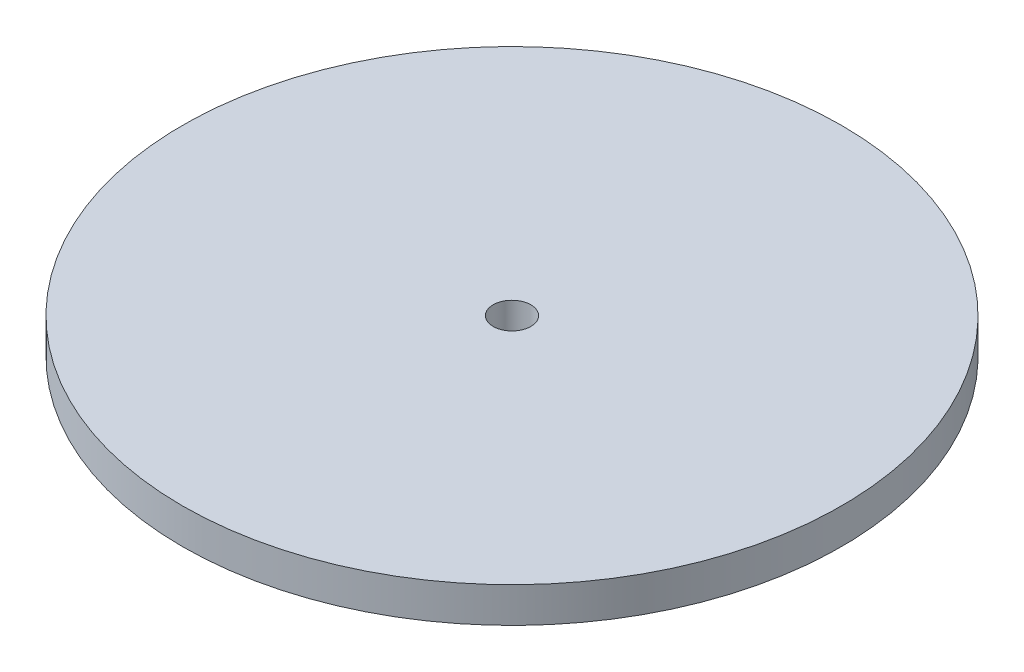
from build123d import *

# Parameters (mm, degrees)
SKETCH2_R           = 140
BOSS_EXTRUDE1_DEPTH = 15
SKETCH3_R           = 8
CUT_EXTRUDE1_DEPTH  = 199.557296517


with BuildPart() as part:
    # Sketch2 → Boss-Extrude1 (new body)
    with BuildSketch(Plane(origin=(0, 0, 0), x_dir=(1, 0, 0), z_dir=(0, 1, 0))):
        Circle(SKETCH2_R)
    extrude(amount=BOSS_EXTRUDE1_DEPTH)

    # Sketch3 → Cut-Extrude1 (cut, through all)
    with BuildSketch(Plane(origin=(0, 15, 0), x_dir=(1, 0, 0), z_dir=(0, 1, 0))):
        Circle(SKETCH3_R)
    extrude(amount=-CUT_EXTRUDE1_DEPTH, mode=Mode.SUBTRACT)


solid = part.part
